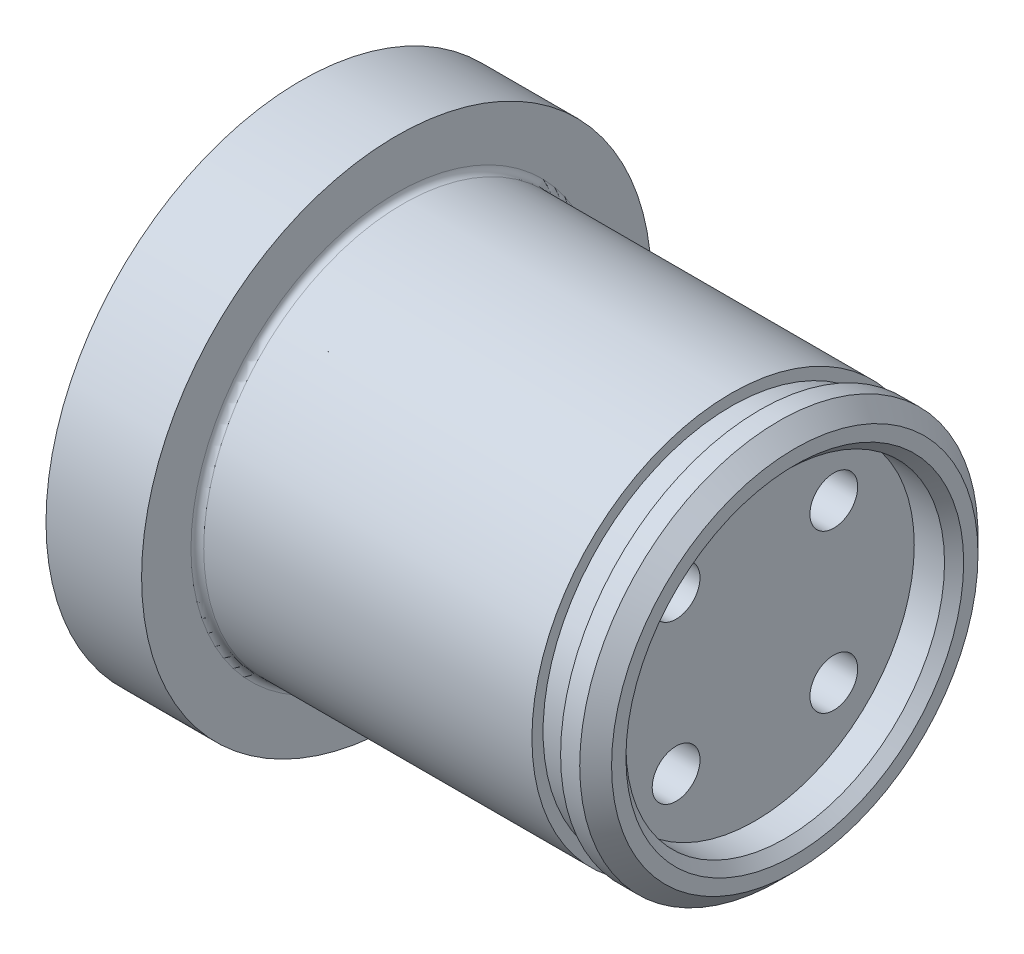
from build123d import *

# Parameters (mm, degrees)
SKETCH_2_W               = 1.8
SKETCH_2_H               = 0.7
CHAMFER_1_SIZE           = 1
FILLET_1_R               = 0.4
HOLE_WIZARD_1_D          = 3
PATTERN_CIRCULAR_1_COUNT = 4
SKETCH_5_W               = 2.5
SKETCH_5_H               = 10
CHAMFER_2_SIZE           = 0.6


with BuildPart() as part:
    # Эскиз1 → Повернуть1 (revolve)
    with BuildSketch(Plane.XY):
        Polygon((0, 0), (0, 12.5), (-25, 12.5), (-25, 16), (-31, 16), (-31, 0), align=None)
    revolve(axis=Axis((0, 0, 0), (1, 0, 0)))

    # Эскиз2 → Вырез-Повернуть1 (revolve, cut)
    with BuildSketch(Plane.XY):
        with Locations((-3.1, 12.15)):
            Rectangle(SKETCH_2_W, SKETCH_2_H)
    revolve(axis=Axis((0, 0, 0), (-1, 0, 0)), mode=Mode.SUBTRACT)

    # Фаска1
    chamfer_1_edges = [part.edges().sort_by_distance(p)[0] for p in [
        (0, -12.5, 0),
    ]]
    chamfer(chamfer_1_edges, length=CHAMFER_1_SIZE)

    # Скругление1
    fillet_1_edges = [part.edges().sort_by_distance(p)[0] for p in [
        (-25, -12.5, 0),
    ]]
    fillet(fillet_1_edges, radius=FILLET_1_R)

    # Отверстие1 (through all)
    with Locations(Plane(origin=(0, 0, 0), x_dir=(0, 0, -1), z_dir=(1, 0, 0))):
        with Locations((4.949747468, 4.949747468)):
            hole_wizard_1 = Hole(HOLE_WIZARD_1_D / 2)

    # Круговой массив1: Отверстие1 ×4 about axis
    pattern_circular_1_axis = Axis((0, 0, 0), (-1, 0, 0))
    for i in range(1, PATTERN_CIRCULAR_1_COUNT):
        add(hole_wizard_1.rotate(pattern_circular_1_axis, i * 360 / PATTERN_CIRCULAR_1_COUNT), mode=Mode.SUBTRACT)

    # Эскиз5 → Вырез-Повернуть2 (revolve, cut)
    with BuildSketch(Plane.XY):
        with Locations((-1.25, 5)):
            Rectangle(SKETCH_5_W, SKETCH_5_H)
    revolve(axis=Axis((0, 0, 0), (-1, 0, 0)), mode=Mode.SUBTRACT)

    # Фаска2
    chamfer_2_edges = [part.edges().sort_by_distance(p)[0] for p in [
        (0, -10, 0),
    ]]
    chamfer(chamfer_2_edges, length=CHAMFER_2_SIZE)


solid = part.part
